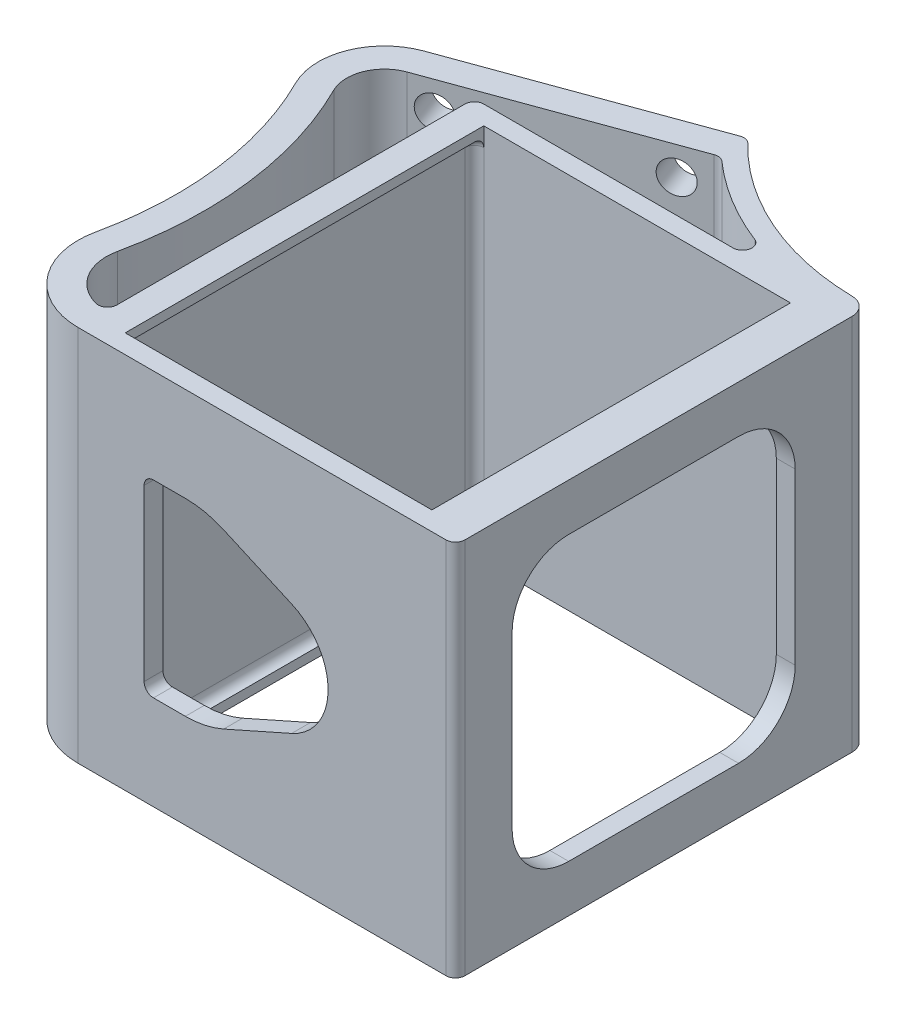
from build123d import *

# Parameters (mm, degrees)
SKIZZE1_W                       = 36
SKIZZE1_H                       = 38
AUFSATZ_LINEAR_AUSTRAGEN2_DEPTH = 40
VERRUNDUNG1_R                   = 1
SCHNITT_LINEAR_AUSTRAGEN1_REACH = 74.681
SKIZZE2_W                       = 30
SKIZZE2_H                       = 30
VERRUNDUNG2_R                   = 6
DURCHGANGSLOCH_F_R_M31_D        = 3.4
DURCHGANGSLOCH_F_R_M31_DEPTH    = 3
DURCHGANGSLOCH_F_R_M31_TIP      = 1.021463052
SKIZZE5_W                       = 2.5
SKIZZE5_H                       = 38
SKIZZE5_W_2                     = 1
AUFSATZ_LINEAR_AUSTRAGEN3_DEPTH = 2
SKIZZE8_W                       = 1
SKIZZE8_H                       = 38
SCHNITT_LINEAR_AUSTRAGEN3_DEPTH = 1
SKIZZE6_W                       = 2.5
SKIZZE6_H                       = 38
SKIZZE6_W_2                     = 1
AUFSATZ_LINEAR_AUSTRAGEN4_DEPTH = 2
SKIZZE9_W                       = 1
SKIZZE9_H                       = 38
SCHNITT_LINEAR_AUSTRAGEN4_DEPTH = 1
VERRUNDUNG3_R                   = 1
VERRUNDUNG4_R                   = 1
SCHNITT_LINEAR_AUSTRAGEN2_REACH = 75.338
VERRUNDUNG9_R                   = 1
VERRUNDUNG10_R                  = 10


with BuildPart() as part:
    # Skizze1 → Aufsatz-Linear austragen2 (new body)
    with BuildSketch(Plane(origin=(0, 0, 0), x_dir=(1, 0, 0), z_dir=(0, 1, 0))):
        with BuildLine():
            Line((20, -21), (20, 21))
            ThreePointArc((20, 21), (19.460793496, 22.319706051), (18.151722222, 22.884241359))
            ThreePointArc((18.151722222, 22.884241359), (7.231561818, 25.331524584), (-1.857986079, 31.859864147))
            Line((-1.857986079, 31.859864147), (-27.041617117, 22.693772058))
            ThreePointArc((-27.041617117, 22.693772058), (-31.15076398, 18.70575902), (-30.908104914, 12.984705575))
            ThreePointArc((-30.908104914, 12.984705575), (-27.294602816, 1.09378988), (-27.822222222, -11.322847799))
            ThreePointArc((-27.822222222, -11.322847799), (-26.22162429, -18.029054702), (-20, -21))
            Line((-20, -21), (20, -21))
        make_face()
        Rectangle(SKIZZE1_W, SKIZZE1_H, mode=Mode.SUBTRACT)
        with BuildLine():
            Line((16, 21), (-20, 21))
            Line((-20, 21), (-20, -18))
            ThreePointArc((-20, -18), (-23.888515181, -16.143159189), (-24.888888889, -11.951779874))
            ThreePointArc((-24.888888889, -11.951779874), (-24.318489531, 1.471612211), (-28.224978285, 14.326656205))
            ThreePointArc((-28.224978285, 14.326656205), (-28.363640609, 17.595829603), (-26.015556687, 19.874694196))
            Line((-26.015556687, 19.874694196), (-1.583548546, 28.767217922))
            ThreePointArc((-1.583548546, 28.767217922), (6.56927519, 23.437142814), (16, 21))
        make_face(mode=Mode.SUBTRACT)
    extrude(amount=AUFSATZ_LINEAR_AUSTRAGEN2_DEPTH)

    # Verrundung1
    verrundung1_edges = [part.edges().sort_by_distance(p)[0] for p in [
        (20, 20, 21),
        (16, 20, -21),
        (-1.583548546, 20, -28.767217922),
        (-20, 20, 18),
        (-20, 20, -21),
    ]]
    fillet(verrundung1_edges, radius=VERRUNDUNG1_R)

    # Skizze2 → Schnitt-Linear austragen1 (cut, up to next)
    with BuildSketch(Plane(origin=(20, 0, 0), x_dir=(0, 0, -1), z_dir=(1, 0, 0)), mode=Mode.PRIVATE) as schnitt_linear_austragen1_sk1:
        with Locations((0, 20)):
            Rectangle(SKIZZE2_W, SKIZZE2_H)
    schnitt_linear_austragen1_tool1 = extrude(schnitt_linear_austragen1_sk1.sketch, amount=-SCHNITT_LINEAR_AUSTRAGEN1_REACH, mode=Mode.PRIVATE) & part.part
    add(schnitt_linear_austragen1_tool1.solids().sort_by_distance((20, 20, 0))[0], mode=Mode.SUBTRACT)

    # Verrundung2
    verrundung2_edges = [part.edges().sort_by_distance(p)[0] for p in [
        (19, 5, 15),
        (19, 35, 15),
        (19, 35, -15),
        (19, 5, -15),
    ]]
    fillet(verrundung2_edges, radius=VERRUNDUNG2_R)

    # Durchgangsloch für M31
    with Locations(Plane(origin=(-10.456906044, 0, -28.730113233), x_dir=(-0.9396926207859081, 0, 0.34202014332566955), z_dir=(-0.34202014332566955, 0, -0.9396926207859082))):
        with Locations((-4.650779494, 37), (15.349220506, 3), (-4.650779494, 3), (15.349220506, 37)):
            Hole(DURCHGANGSLOCH_F_R_M31_D / 2, depth=DURCHGANGSLOCH_F_R_M31_DEPTH)
            with Locations((0, 0, -(DURCHGANGSLOCH_F_R_M31_DEPTH + DURCHGANGSLOCH_F_R_M31_TIP / 2))):  # 118° drill point
                Cone(0, DURCHGANGSLOCH_F_R_M31_D / 2, DURCHGANGSLOCH_F_R_M31_TIP, mode=Mode.SUBTRACT)

    # Skizze5 → Aufsatz-Linear austragen3 (add)
    with BuildSketch(Plane.XZ):
        with Locations((16.75, 0)):
            Rectangle(SKIZZE5_W, SKIZZE5_H)
        with Locations((-17.5, 0)):
            Rectangle(SKIZZE5_W_2, SKIZZE5_H)
    extrude(amount=-AUFSATZ_LINEAR_AUSTRAGEN3_DEPTH)

    # Skizze8 → Schnitt-Linear austragen3 (cut)
    with BuildSketch(Plane(origin=(0, 2, 0), x_dir=(1, 0, 0), z_dir=(0, 1, 0))):
        with Locations((-17.5, 0)):
            Rectangle(SKIZZE8_W, SKIZZE8_H)
    extrude(amount=-SCHNITT_LINEAR_AUSTRAGEN3_DEPTH, mode=Mode.SUBTRACT)

    # Skizze6 → Aufsatz-Linear austragen4 (add)
    with BuildSketch(Plane(origin=(0, 40, 0), x_dir=(1, 0, 0), z_dir=(0, 1, 0))):
        with Locations((16.75, 0)):
            Rectangle(SKIZZE6_W, SKIZZE6_H)
        with Locations((-17.5, 0)):
            Rectangle(SKIZZE6_W_2, SKIZZE6_H)
    extrude(amount=-AUFSATZ_LINEAR_AUSTRAGEN4_DEPTH)

    # Skizze9 → Schnitt-Linear austragen4 (cut)
    with BuildSketch(Plane.XZ.offset(-38)):
        with Locations((-17.5, 0)):
            Rectangle(SKIZZE9_W, SKIZZE9_H)
    extrude(amount=-SCHNITT_LINEAR_AUSTRAGEN4_DEPTH, mode=Mode.SUBTRACT)

    # Verrundung3
    verrundung3_edges = [part.edges().sort_by_distance(p)[0] for p in [
        (16.75, 2, 19),
        (18, 2, 0),
        (16.75, 2, -19),
        (-17.5, 1, 19),
        (-18, 1, 0),
        (-17.5, 1, -19),
        (18, 20, -19),
        (18, 20, 19),
        (16.75, 38, -19),
        (18, 38, 0),
        (16.75, 38, 19),
        (-18, 20, -19),
        (-18, 20, 19),
        (-17.5, 39, -19),
        (-18, 39, 0),
        (-17.5, 39, 19),
    ]]
    fillet(verrundung3_edges, radius=VERRUNDUNG3_R - 0.0001)  # a hair under: the kernel refuses the full size

    # Verrundung4
    verrundung4_edges = [part.edges().sort_by_distance(p)[0] for p in [
        (-1.857986079, 20, -31.859864147),
    ]]
    fillet(verrundung4_edges, radius=VERRUNDUNG4_R)

    # Skizze7 → Schnitt-Linear austragen2 (cut, up to next)
    with BuildSketch(Plane.XY.offset(21), mode=Mode.PRIVATE) as schnitt_linear_austragen2_sk1:
        with BuildLine():
            Line((-13, 10), (-6.5, 10))
            Line((-6.5, 10), (2.63884007, 14.059753954))
            ThreePointArc((2.63884007, 14.059753954), (6.5, 20), (2.63884007, 25.940246046))
            Line((2.63884007, 25.940246046), (-6.5, 30))
            Line((-6.5, 30), (-13, 30))
            Line((-13, 30), (-13, 10))
        make_face()
    schnitt_linear_austragen2_tool1 = extrude(schnitt_linear_austragen2_sk1.sketch, amount=-SCHNITT_LINEAR_AUSTRAGEN2_REACH, mode=Mode.PRIVATE) & part.part
    add(schnitt_linear_austragen2_tool1.solids().sort_by_distance((-4.747297, 20, 21))[0], mode=Mode.SUBTRACT)

    # Verrundung9
    verrundung9_edges = [part.edges().sort_by_distance(p)[0] for p in [
        (-13, 10, 20),
        (-13, 30, 20),
    ]]
    fillet(verrundung9_edges, radius=VERRUNDUNG9_R)

    # Verrundung10
    verrundung10_edges = [part.edges().sort_by_distance(p)[0] for p in [
        (-6.5, 30, 20),
        (-6.5, 10, 20),
    ]]
    fillet(verrundung10_edges, radius=VERRUNDUNG10_R)


solid = part.part
